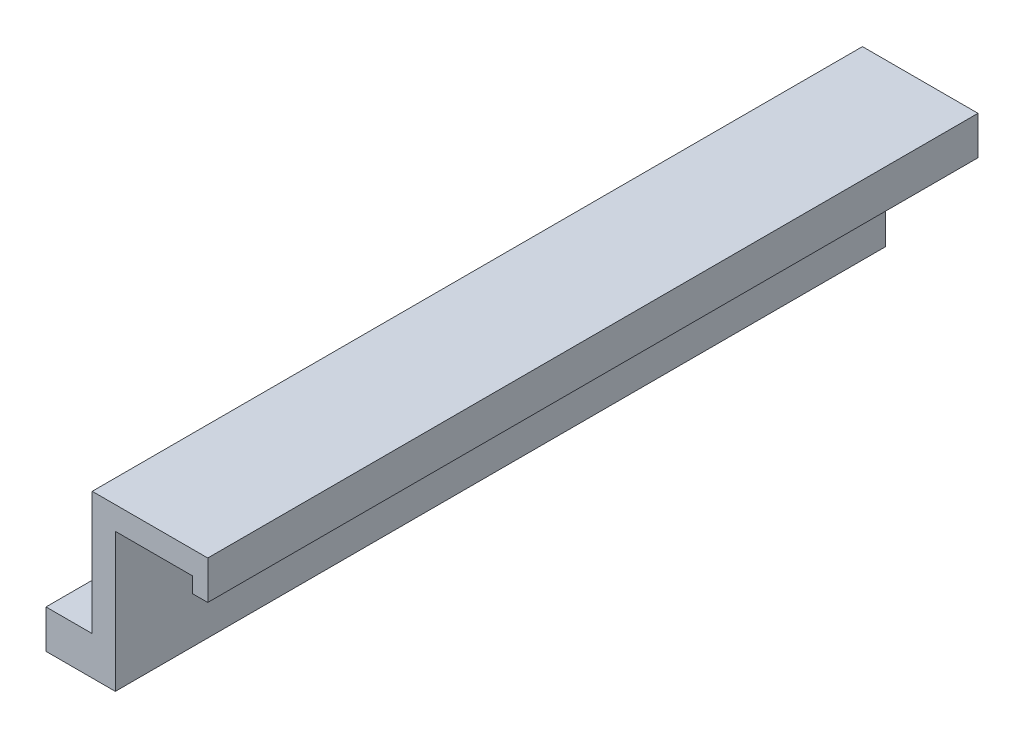
from build123d import *

# Parameters (mm, degrees)
SKETCH1_W            = 100
SKETCH1_H            = 26
BOSS_EXTRUDE1_DEPTH  = 2
BOSS_EXTRUDE2_DEPTH  = 100
MOVE_START           = -100
MOVE_FACE1_OUTLINE_W = 2
MOVE_FACE1_OUTLINE_H = 28
MOVE_FACE1_DEPTH     = 100
SKETCH5_W            = 100
SKETCH5_H            = 4
BOSS_EXTRUDE3_DEPTH  = 6
SKETCH6_W            = 100
SKETCH6_H            = 4
BOSS_EXTRUDE4_DEPTH  = 4
SKETCH7_W            = 6
SKETCH7_H            = 100
BOSS_EXTRUDE5_DEPTH  = 11.5
MOVE_FACE2_BY        = 12
SKETCH8_W            = 6
SKETCH8_H            = 42.5
BOSS_EXTRUDE6_DEPTH  = 1.5
SKETCH9_R            = 1.75
CUT_EXTRUDE1_DEPTH   = 103.376755174
MOVE_FACE3_BY        = 1
MOVE_FACE3_2_BY      = 1
MOVE_FACE3_3_BY      = 1
MOVE_FACE4_BY        = 1


# Read off the part's stored shape, not the designer's step: Move Face1
with BuildPart() as part:
    # Sketch1 → Boss-Extrude1 (new body)
    with BuildSketch(Plane(origin=(0, 0, 0), x_dir=(0, 0, -1), z_dir=(1, 0, 0))):
        with Locations((50, 13)):
            Rectangle(SKETCH1_W, SKETCH1_H)
    extrude(amount=BOSS_EXTRUDE1_DEPTH)

    # Sketch2 → Boss-Extrude2 (add)
    with BuildSketch(Plane.XY):
        Polygon((2, 26), (2, 28), (-12, 28), (-12, 24), (-10, 24), (-10, 26), align=None)
    extrude(amount=-BOSS_EXTRUDE2_DEPTH)


with BuildPart() as body_2:
    # Mirror1: mirrored copy
    add(part.part.mirror(Plane.ZY.offset(-2)))

    # Move Face1 outline → Move Face1 (add)
    with BuildSketch(Plane.XY.offset(MOVE_START)):
        with Locations((1, 14)):
            Rectangle(MOVE_FACE1_OUTLINE_W, MOVE_FACE1_OUTLINE_H)
    extrude(amount=MOVE_FACE1_DEPTH)



with BuildPart() as body_2_2:
    # Sketch5 → Boss-Extrude3 (new body)
    with BuildSketch(Plane.ZY):
        with Locations((-50, -2)):
            Rectangle(SKETCH5_W, SKETCH5_H)
    extrude(amount=BOSS_EXTRUDE3_DEPTH)


with BuildPart() as body_2_1:
    add(body_2.part)

    add(body_2_2.part)  # Boss-Extrude4 merges body 2 2
    # Sketch6 → Boss-Extrude4 (add)
    with BuildSketch(Plane(origin=(0, 0, 0), x_dir=(0, 0, -1), z_dir=(1, 0, 0))):
        with Locations((50, -2)):
            Rectangle(SKETCH6_W, SKETCH6_H)
    extrude(amount=BOSS_EXTRUDE4_DEPTH)

    # Sketch7 → Boss-Extrude5 (add)
    with BuildSketch(Plane(origin=(0, 0, 0), x_dir=(1, 0, 0), z_dir=(0, 1, 0))):
        with Locations((-3, 50)):
            Rectangle(SKETCH7_W, SKETCH7_H)
    extrude(amount=BOSS_EXTRUDE5_DEPTH)

    # Move Face2: a face moved inward by 12.0
    extrude(body_2_1.faces().sort_by_distance((-1, -4, -50))[0], amount=MOVE_FACE2_BY, dir=(0, 1, 0), mode=Mode.SUBTRACT)

    # Sketch8 → Boss-Extrude6 (add)
    with BuildSketch(Plane(origin=(0, 11.5, 0), x_dir=(1, 0, 0), z_dir=(0, 1, 0))):
        with Locations((-3, 78.75)):
            Rectangle(SKETCH8_W, SKETCH8_H)
        with Locations((-3, 21.25)):
            Rectangle(SKETCH8_W, SKETCH8_H)
    extrude(amount=BOSS_EXTRUDE6_DEPTH)

    # Sketch9 → Cut-Extrude1 (cut, through all)
    with BuildSketch(Plane(origin=(0, 13, 0), x_dir=(1, 0, 0), z_dir=(0, 1, 0))):
        with Locations(Location((-3, 33.28320942, 0), (0, 0, 270))):
            Circle(SKETCH9_R)
        with Locations(Location((-3, 65.85, 0), (0, 0, 270))):
            Circle(SKETCH9_R)
    extrude(amount=-CUT_EXTRUDE1_DEPTH, mode=Mode.SUBTRACT)

    # Move Face3: a face moved inward by 1.0
    extrude(body_2_1.faces().sort_by_distance((16, 26, -50))[0], amount=MOVE_FACE3_BY, dir=(-1, 0, 0), mode=Mode.SUBTRACT)

    # Move Face3 2: a face moved inward by 1.0
    extrude(body_2_1.faces().sort_by_distance((4, 17, -50))[0], amount=MOVE_FACE3_2_BY, dir=(-1, 0, 0), mode=Mode.SUBTRACT)

    # Move Face3 3: a face moved outward by 1.0
    extrude(body_2_1.faces().sort_by_distance((14, 25, -50))[0], amount=MOVE_FACE3_3_BY, dir=(-1, 0, 0))

    # Move Face4: a face moved outward by 1.0
    extrude(body_2_1.faces().sort_by_distance((7.5, 28, -50))[0], amount=MOVE_FACE4_BY, dir=(0, 1, 0))


solid = body_2_1.part
